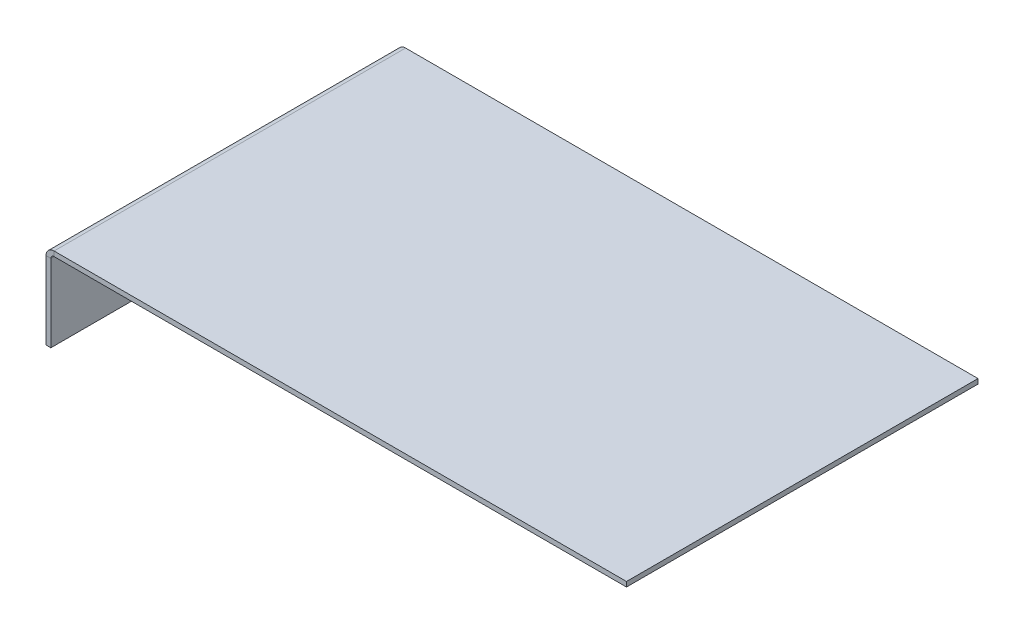
from build123d import *

# Parameters (mm, degrees)
SKETCH_1_W                       = 180
SKETCH_1_H                       = 109
SM_BASE_FLANGE_1_DEPTH           = 1.5
SM_EDGE_FLANGE_1_STRIP_W         = 8
SM_EDGE_FLANGE_1_STRIP_H         = 1.5
SM_EDGE_FLANGE_1_STRIP_CUT_DEPTH = 109
SM_EDGE_FLANGE_1_DEPTH           = 109


# Sheet-metal steps are written as plain solids
with BuildPart() as part:
    # Sketch 1 → 基体-法兰1 (new body)
    with BuildSketch(Plane(origin=(0, 0, 0), x_dir=(1, 0, 0), z_dir=(0, 1, 0))):
        Rectangle(SKETCH_1_W, SKETCH_1_H)
    extrude(amount=-SM_BASE_FLANGE_1_DEPTH)

    # 边线-法兰1 strip (across the edge) → 边线-法兰1 strip cut (cut)
    with BuildSketch(Plane(origin=(-90, -1.5, 54.5), x_dir=(1, 0, 0), z_dir=(0, 0, -1))):
        with Locations((-1.5, -0.75)):
            Rectangle(SM_EDGE_FLANGE_1_STRIP_W, SM_EDGE_FLANGE_1_STRIP_H)
    extrude(amount=SM_EDGE_FLANGE_1_STRIP_CUT_DEPTH, mode=Mode.SUBTRACT)

    # 边线-法兰1 section (across the edge) → 边线-法兰1 (add)
    with BuildSketch(Plane(origin=(-90, -1.5, 54.5), x_dir=(1, 0, 0), z_dir=(0, 0, -1))):
        with BuildLine():
            Line((0, 1), (0, 25))
            Line((0, 25), (1.5, 25))
            Line((1.5, 25), (1.5, 1))
            ThreePointArc((1.5, 1), (1.792893219, 0.292893219), (2.5, 0))
            Line((2.5, 0), (2.5, -1.5))
            ThreePointArc((2.5, -1.5), (0.732233047, -0.767766953), (0, 1))
        make_face()
    extrude(amount=SM_EDGE_FLANGE_1_DEPTH)


solid = part.part
